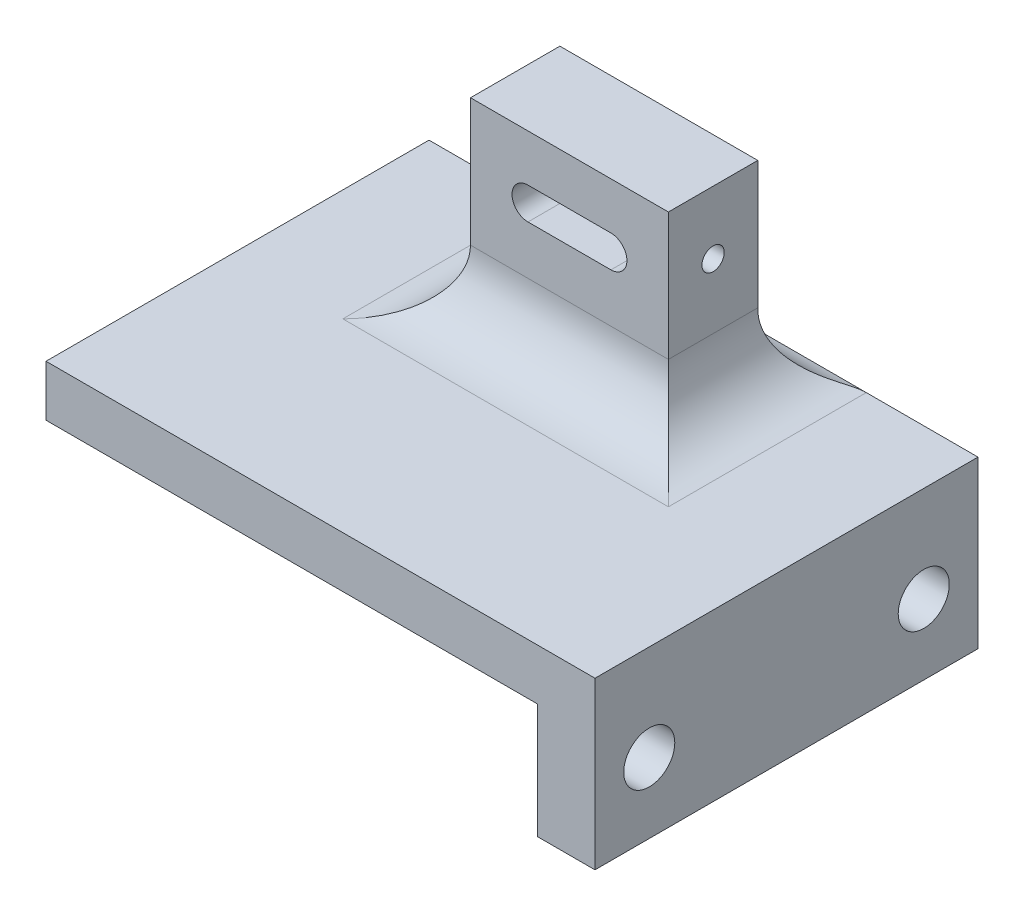
from build123d import *

# Parameters (mm, degrees)
SKETCH1_W                               = 77
SKETCH1_H                               = 60
BOSS_EXTRUDE1_DEPTH                     = 8
SKETCH3_W                               = 60
SKETCH3_H                               = 26
BOSS_EXTRUDE2_DEPTH                     = 9
SKETCH4_R                               = 4
CUT_EXTRUDE2_DEPTH                      = 107.395488626
SKETCH5_W                               = 31
SKETCH5_H                               = 14
BOSS_EXTRUDE3_DEPTH                     = 30
CUT_EXTRUDE3_DEPTH                      = 108.930533215
FILLET1_R                               = 10
SKETCH8_R                               = 1.75
F_3_5MM_SCREW_HOLE_FOR_TENSIONING_DEPTH = 93.012227514


with BuildPart() as part:
    # Sketch1 → Boss-Extrude1 (new body)
    with BuildSketch(Plane(origin=(0, 0, 0), x_dir=(1, 0, 0), z_dir=(0, 1, 0))):
        with Locations((38.5, 30)):
            Rectangle(SKETCH1_W, SKETCH1_H)
    extrude(amount=BOSS_EXTRUDE1_DEPTH)

    # Sketch3 → Boss-Extrude2 (add)
    with BuildSketch(Plane(origin=(77, 0, 0), x_dir=(0, 0, -1), z_dir=(1, 0, 0))):
        with Locations((30, -5)):
            Rectangle(SKETCH3_W, SKETCH3_H)
    extrude(amount=BOSS_EXTRUDE2_DEPTH)

    # Sketch4 → Cut-Extrude2 (cut, through all)
    with BuildSketch(Plane(origin=(86, 0, 0), x_dir=(0, 0, -1), z_dir=(1, 0, 0))):
        with Locations((8.5, -7)):
            Circle(SKETCH4_R)
        with Locations(Location((51.5, -7, 0), (0, 0, 180))):
            Circle(SKETCH4_R)
    extrude(amount=-CUT_EXTRUDE2_DEPTH, mode=Mode.SUBTRACT)

    # Sketch5 → Boss-Extrude3 (add)
    with BuildSketch(Plane(origin=(0, 8, 0), x_dir=(1, 0, 0), z_dir=(0, 1, 0))):
        with Locations((43, 46)):
            Rectangle(SKETCH5_W, SKETCH5_H)
    extrude(amount=BOSS_EXTRUDE3_DEPTH)

    # Sketch6 → Cut-Extrude3 (cut, through all)
    with BuildSketch(Plane(origin=(0, 0, -53), x_dir=(-1, 0, 0), z_dir=(0, 0, -1))):
        with BuildLine():
            Line((-49.500000097, 30.65), (-36.499999903, 30.65))
            ThreePointArc((-36.499999903, 30.65), (-33.999999903, 28.15), (-36.499999903, 25.65))
            Line((-36.499999903, 25.65), (-49.500000097, 25.65))
            ThreePointArc((-49.500000097, 25.65), (-52.000000097, 28.15), (-49.500000097, 30.65))
        make_face()
    extrude(amount=-CUT_EXTRUDE3_DEPTH, mode=Mode.SUBTRACT)

    # Fillet1
    # the kernel refuses this fillet: 10 mm, written as the material it adds along each edge
    with BuildSketch(Plane(origin=(58.5, 8, -53), x_dir=(0, 0, -1), z_dir=(-1, 0, 0))) as fillet1_piece_1:
        with BuildLine():
            CenterArc((10, -9.539392014), FILLET1_R, 107.457603124, 72.542396876)
            Line((0, -9.539392014), (-0.2, -9.539392014))
            Line((-0.2, -9.539392014), (-0.2, 0))
            Line((-0.2, 0), (0, 0.2))
            ThreePointArc((0, 0.2), (3.5, 0.2), (6.94, 0.19078784))
            Line((6.94, 0.19078784), (7, 0))
        make_face()
    extrude(amount=31)
    with BuildSketch(Plane(origin=(27.5, 8, -53), x_dir=(-1, 0, 0), z_dir=(0, 0, 1)), Plane(origin=(58.5, 8, -39), x_dir=(1, 0, 0), z_dir=(0, 0, -1))) as fillet1_piece_2:
        with BuildLine():
            CenterArc((FILLET1_R, -FILLET1_R), FILLET1_R, 90, 90)
            Line((0, -FILLET1_R), (-FILLET1_R * 0.02, -FILLET1_R))
            Line((-FILLET1_R * 0.02, -FILLET1_R), (-FILLET1_R * 0.02, FILLET1_R * 0.02))
            Line((-FILLET1_R * 0.02, FILLET1_R * 0.02), (FILLET1_R, FILLET1_R * 0.02))
            Line((FILLET1_R, FILLET1_R * 0.02), (FILLET1_R, 0))
        make_face()
    extrude(amount=14)
    with BuildSketch(Plane(origin=(27.5, 8, -39), x_dir=(0, 0, 1), z_dir=(1, 0, 0))) as fillet1_piece_3:
        with BuildLine():
            CenterArc((FILLET1_R, -FILLET1_R), FILLET1_R, 90, 90)
            Line((0, -FILLET1_R), (-FILLET1_R * 0.02, -FILLET1_R))
            Line((-FILLET1_R * 0.02, -FILLET1_R), (-FILLET1_R * 0.02, FILLET1_R * 0.02))
            Line((-FILLET1_R * 0.02, FILLET1_R * 0.02), (FILLET1_R, FILLET1_R * 0.02))
            Line((FILLET1_R, FILLET1_R * 0.02), (FILLET1_R, 0))
        make_face()
    extrude(amount=31)
    with BuildSketch(Plane(origin=(82.348480035, 8, -53), x_dir=(0, 0, -1), z_dir=(-1, 0, 0))) as fillet1_piece_4a_section:
        with BuildLine():
            CenterArc((10, -9.539392014), FILLET1_R, 107.457603124, 72.542396876)
            Line((0, -9.539392014), (-0.2, -9.539392014))
            Line((-0.2, -9.539392014), (-0.2, 0))
            Line((-0.2, 0), (0, 0.2))
            ThreePointArc((0, 0.2), (3.5, 0.2), (6.94, 0.19078784))
            Line((6.94, 0.19078784), (7, 0))
        make_face()
    fillet1_piece_4a = extrude(amount=54.848480035, mode=Mode.PRIVATE)
    fillet1_piece_4a = split(fillet1_piece_4a, bisect_by=Plane(origin=(58.5, 10.271225878, -54.787817996), z_dir=(1, 0, 0)), keep=Keep.TOP, mode=Mode.PRIVATE)
    with BuildSketch(Plane(origin=(58.5, 8, -39), x_dir=(1, 0, 0), z_dir=(0, 0, -1))) as fillet1_piece_4b_section:
        with BuildLine():
            CenterArc((FILLET1_R, -FILLET1_R), FILLET1_R, 90, 90)
            Line((0, -FILLET1_R), (-FILLET1_R * 0.02, -FILLET1_R))
            Line((-FILLET1_R * 0.02, -FILLET1_R), (-FILLET1_R * 0.02, FILLET1_R * 0.02))
            Line((-FILLET1_R * 0.02, FILLET1_R * 0.02), (FILLET1_R, FILLET1_R * 0.02))
            Line((FILLET1_R, FILLET1_R * 0.02), (FILLET1_R, 0))
        make_face()
    fillet1_piece_4b = extrude(amount=39, mode=Mode.PRIVATE)
    fillet1_piece_4b = split(fillet1_piece_4b, bisect_by=Plane(origin=(60.763951143, 10.263951143, -60), z_dir=(0, 0, 1)), keep=Keep.TOP, mode=Mode.PRIVATE)
    fillet1_piece_4b = split(fillet1_piece_4b, bisect_by=Plane(origin=(60.763951143, 10.263951143, -53), z_dir=(0, 0, -1)), keep=Keep.TOP, mode=Mode.PRIVATE)
    fillet1_piece_4 = fillet1_piece_4a & fillet1_piece_4b
    add(fillet1_piece_4)
    with BuildSketch(Plane(origin=(58.5, 8, -53), x_dir=(0, 0, -1), z_dir=(-1, 0, 0))) as fillet1_piece_5a_section:
        with BuildLine():
            CenterArc((10, -9.539392014), FILLET1_R, 107.457603124, 72.542396876)
            Line((0, -9.539392014), (-0.2, -9.539392014))
            Line((-0.2, -9.539392014), (-0.2, 0))
            Line((-0.2, 0), (0, 0.2))
            ThreePointArc((0, 0.2), (3.5, 0.2), (6.94, 0.19078784))
            Line((6.94, 0.19078784), (7, 0))
        make_face()
    fillet1_piece_5a = extrude(amount=54.848480035, mode=Mode.PRIVATE)
    fillet1_piece_5a = split(fillet1_piece_5a, bisect_by=Plane(origin=(27.5, 10.271225878, -54.787817996), z_dir=(-1, 0, 0)), keep=Keep.TOP, mode=Mode.PRIVATE)
    with BuildSketch(Plane(origin=(27.5, 8, -78), x_dir=(-1, 0, 0), z_dir=(0, 0, 1))) as fillet1_piece_5b_section:
        with BuildLine():
            CenterArc((FILLET1_R, -FILLET1_R), FILLET1_R, 90, 90)
            Line((0, -FILLET1_R), (-FILLET1_R * 0.02, -FILLET1_R))
            Line((-FILLET1_R * 0.02, -FILLET1_R), (-FILLET1_R * 0.02, FILLET1_R * 0.02))
            Line((-FILLET1_R * 0.02, FILLET1_R * 0.02), (FILLET1_R, FILLET1_R * 0.02))
            Line((FILLET1_R, FILLET1_R * 0.02), (FILLET1_R, 0))
        make_face()
    fillet1_piece_5b = extrude(amount=39, mode=Mode.PRIVATE)
    fillet1_piece_5b = split(fillet1_piece_5b, bisect_by=Plane(origin=(25.236048857, 10.263951143, -60), z_dir=(0, 0, 1)), keep=Keep.TOP, mode=Mode.PRIVATE)
    fillet1_piece_5b = split(fillet1_piece_5b, bisect_by=Plane(origin=(25.236048857, 10.263951143, -53), z_dir=(0, 0, -1)), keep=Keep.TOP, mode=Mode.PRIVATE)
    fillet1_piece_5 = fillet1_piece_5a & fillet1_piece_5b
    add(fillet1_piece_5)
    with BuildSketch(Plane(origin=(27.5, 8, -53), x_dir=(-1, 0, 0), z_dir=(0, 0, 1))) as fillet1_piece_6a_section:
        with BuildLine():
            CenterArc((FILLET1_R, -FILLET1_R), FILLET1_R, 90, 90)
            Line((0, -FILLET1_R), (-FILLET1_R * 0.02, -FILLET1_R))
            Line((-FILLET1_R * 0.02, -FILLET1_R), (-FILLET1_R * 0.02, FILLET1_R * 0.02))
            Line((-FILLET1_R * 0.02, FILLET1_R * 0.02), (FILLET1_R, FILLET1_R * 0.02))
            Line((FILLET1_R, FILLET1_R * 0.02), (FILLET1_R, 0))
        make_face()
    fillet1_piece_6a = extrude(amount=39, mode=Mode.PRIVATE)
    fillet1_piece_6a = split(fillet1_piece_6a, bisect_by=Plane(origin=(25.236048857, 10.263951143, -39), z_dir=(0, 0, 1)), keep=Keep.TOP, mode=Mode.PRIVATE)
    with BuildSketch(Plane(origin=(2.5, 8, -39), x_dir=(0, 0, 1), z_dir=(1, 0, 0))) as fillet1_piece_6b_section:
        with BuildLine():
            CenterArc((FILLET1_R, -FILLET1_R), FILLET1_R, 90, 90)
            Line((0, -FILLET1_R), (-FILLET1_R * 0.02, -FILLET1_R))
            Line((-FILLET1_R * 0.02, -FILLET1_R), (-FILLET1_R * 0.02, FILLET1_R * 0.02))
            Line((-FILLET1_R * 0.02, FILLET1_R * 0.02), (FILLET1_R, FILLET1_R * 0.02))
            Line((FILLET1_R, FILLET1_R * 0.02), (FILLET1_R, 0))
        make_face()
    fillet1_piece_6b = extrude(amount=56, mode=Mode.PRIVATE)
    fillet1_piece_6b = split(fillet1_piece_6b, bisect_by=Plane(origin=(27.5, 10.263951143, -36.736048857), z_dir=(-1, 0, 0)), keep=Keep.TOP, mode=Mode.PRIVATE)
    fillet1_piece_6 = fillet1_piece_6a & fillet1_piece_6b
    add(fillet1_piece_6)
    with BuildSketch(Plane(origin=(27.5, 8, -39), x_dir=(0, 0, 1), z_dir=(1, 0, 0))) as fillet1_piece_7a_section:
        with BuildLine():
            CenterArc((FILLET1_R, -FILLET1_R), FILLET1_R, 90, 90)
            Line((0, -FILLET1_R), (-FILLET1_R * 0.02, -FILLET1_R))
            Line((-FILLET1_R * 0.02, -FILLET1_R), (-FILLET1_R * 0.02, FILLET1_R * 0.02))
            Line((-FILLET1_R * 0.02, FILLET1_R * 0.02), (FILLET1_R, FILLET1_R * 0.02))
            Line((FILLET1_R, FILLET1_R * 0.02), (FILLET1_R, 0))
        make_face()
    fillet1_piece_7a = extrude(amount=56, mode=Mode.PRIVATE)
    fillet1_piece_7a = split(fillet1_piece_7a, bisect_by=Plane(origin=(58.5, 10.263951143, -36.736048857), z_dir=(1, 0, 0)), keep=Keep.TOP, mode=Mode.PRIVATE)
    with BuildSketch(Plane(origin=(58.5, 8, -14), x_dir=(1, 0, 0), z_dir=(0, 0, -1))) as fillet1_piece_7b_section:
        with BuildLine():
            CenterArc((FILLET1_R, -FILLET1_R), FILLET1_R, 90, 90)
            Line((0, -FILLET1_R), (-FILLET1_R * 0.02, -FILLET1_R))
            Line((-FILLET1_R * 0.02, -FILLET1_R), (-FILLET1_R * 0.02, FILLET1_R * 0.02))
            Line((-FILLET1_R * 0.02, FILLET1_R * 0.02), (FILLET1_R, FILLET1_R * 0.02))
            Line((FILLET1_R, FILLET1_R * 0.02), (FILLET1_R, 0))
        make_face()
    fillet1_piece_7b = extrude(amount=39, mode=Mode.PRIVATE)
    fillet1_piece_7b = split(fillet1_piece_7b, bisect_by=Plane(origin=(60.763951143, 10.263951143, -39), z_dir=(0, 0, 1)), keep=Keep.TOP, mode=Mode.PRIVATE)
    fillet1_piece_7 = fillet1_piece_7a & fillet1_piece_7b
    add(fillet1_piece_7)

    # Sketch8 → 3.5mm screw hole for tensioning (cut, through all)
    with BuildSketch(Plane(origin=(58.5, 0, 0), x_dir=(0, 0, -1), z_dir=(1, 0, 0))):
        with Locations((46, 28.15)):
            Circle(SKETCH8_R)
    extrude(amount=-F_3_5MM_SCREW_HOLE_FOR_TENSIONING_DEPTH, mode=Mode.SUBTRACT)


solid = part.part
